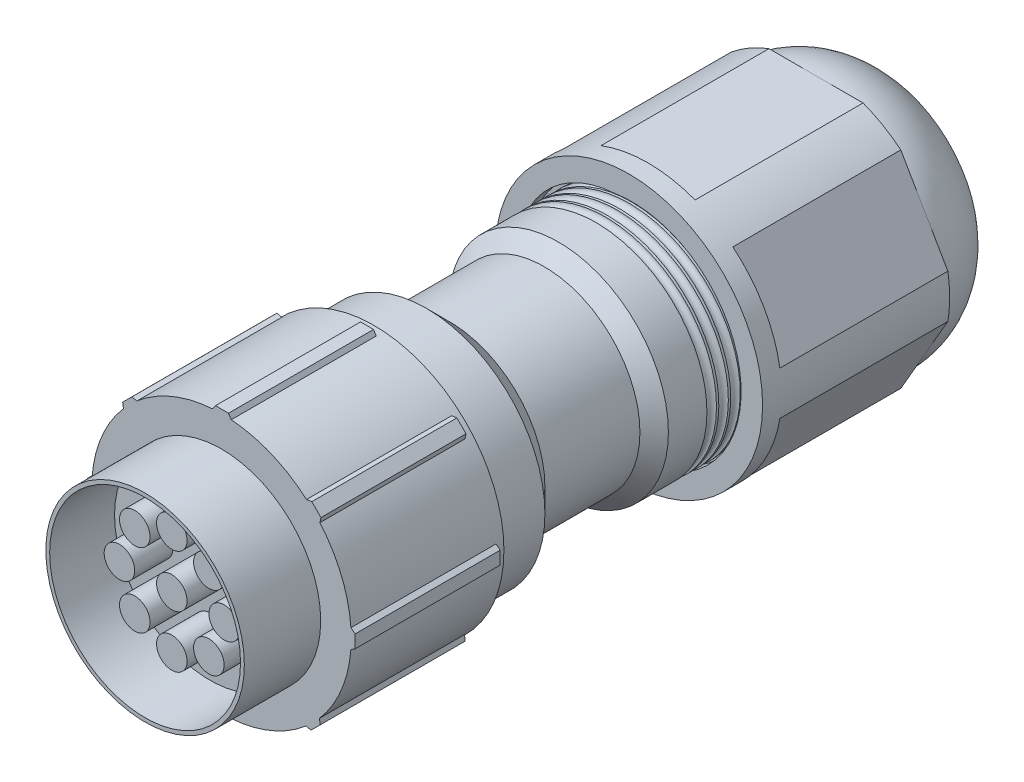
from build123d import *

# Parameters (mm, degrees)
SKETCH1_R           = 8.5
BOSS_EXTRUDE1_DEPTH = 10
SKETCH2_R           = 6.5
BOSS_EXTRUDE2_DEPTH = 5
BOSS_EXTRUDE3_START = 3.5
SKETCH4_R           = 7.195040541
BOSS_EXTRUDE3_DEPTH = 3.5
CUT_SWEEP2_PITCH    = 0.777777778
SKETCH7_R           = 8.75
BOSS_EXTRUDE5_DEPTH = 11.5
SKETCH10_R          = 3
CUT_EXTRUDE1_DEPTH  = 3
SKETCH11_R          = 6.25
CUT_EXTRUDE2_DEPTH  = 4.25
SKETCH12_R          = 1
BOSS_EXTRUDE6_DEPTH = 2.5
CIRPATTERN1_COUNT   = 8
BOSS_EXTRUDE7_DEPTH = 9.5
CIRPATTERN2_COUNT   = 8
BOSS_EXTRUDE8_START = 0.75
BOSS_EXTRUDE8_DEPTH = 0.75
CUT_EXTRUDE3_DEPTH  = 11
CIRPATTERN3_COUNT   = 6


with BuildPart() as part:
    # Sketch1 → Boss-Extrude1 (new body)
    with BuildSketch(Plane.XY):
        Circle(SKETCH1_R)
    extrude(amount=-BOSS_EXTRUDE1_DEPTH)

    # Sketch2 → Boss-Extrude2 (add)
    with BuildSketch(Plane.XY):
        Circle(SKETCH2_R)
    extrude(amount=BOSS_EXTRUDE2_DEPTH)

    # Sketch3 → Revolve1 (revolve)
    with BuildSketch(Plane(origin=(0, 0, 0), x_dir=(0, 0, -1), z_dir=(1, 0, 0)), mode=Mode.PRIVATE) as revolve1_sk:
        Polygon((10, 7.766162729), (13.419300919, 7.766162729), (14.922254046, 6.263209602), (21.14447999, 6.263209602), (22.076310929, 7.195040541), (23.939972806, 7.195040541), (23.939972806, 0), (10, 0), align=None)
    revolve(revolve1_sk.sketch.rotate(Axis((0, 0, -23.939972806), (0, 0, 1)), 90), axis=Axis((0, 0, -23.939972806), (0, 0, 1)))

    # Sketch4 → Boss-Extrude3 (add)
    with BuildSketch(Plane(origin=(0, 0, -23.939972806), x_dir=(-1, 0, 0), z_dir=(0, 0, -1)).offset(BOSS_EXTRUDE3_START)):
        Circle(SKETCH4_R)
    extrude(amount=-BOSS_EXTRUDE3_DEPTH)

    # Cut-Sweep2: arcs per turn and ends read off the stored shape
    # Cut-Sweep2: the profile of Sketch6 screwed along a right-hand helix through 4 turns, 8 arcs to a turn; built about Z, then put on its axis
    cut_sweep2_z = Axis((0, 0, 0), (0, 0, 1))
    cut_sweep2_corners = [(-7.195040541, 0, -0.312225385), (-6.882815156, 0, 0), (-7.195040541, 0, 0.312225385), (-7.507265926, 0, 0)]
    with BuildLine(mode=Mode.PRIVATE) as cut_sweep2_profile:
        ThreePointArc((-7.195040541, 0, -0.312225385), (-6.974263854, 0, -0.220776687), (-6.882815156, 0, 0))
        ThreePointArc((-6.882815156, 0, 0), (-6.974263854, 0, 0.220776687), (-7.195040541, 0, 0.312225385))
        ThreePointArc((-7.195040541, 0, 0.312225385), (-7.415817228, 0, 0.220776687), (-7.507265926, 0, 0))
        ThreePointArc((-7.507265926, 0, 0), (-7.415817228, 0, -0.220776687), (-7.195040541, 0, -0.312225385))
    cut_sweep2_cap = Face(cut_sweep2_profile.wire())
    cut_sweep2_arcs = [((-7.195040541, 0, -0.312225385), (-6.882815156, 0, -0.312225385), (-6.882815156, 0, 0), (1, 0.7071067811865476, 1)), ((-6.882815156, 0, 0), (-6.882815156, 0, 0.312225385), (-7.195040541, 0, 0.312225385), (1, 0.7071067811865476, 1)), ((-7.195040541, 0, 0.312225385), (-7.507265926, 0, 0.312225385), (-7.507265926, 0, 0), (1, 0.7071067811865476, 1)), ((-7.507265926, 0, 0), (-7.507265926, 0, -0.312225385), (-7.195040541, 0, -0.312225385), (1, 0.7071067811865476, 1))]  # start, shoulder, end, weights
    cut_sweep2_turn_angles = [0, 22.5, 45, 67.5, 90, 112.5, 135, 157.5, 180, 202.5, 225, 247.5, 270, 292.5, 315, 337.5, 360]
    cut_sweep2_turn_weights = [1, 0.9238795325112867, 1, 0.9238795325112867, 1, 0.9238795325112867, 1, 0.9238795325112867, 1, 0.9238795325112867, 1, 0.9238795325112867, 1, 0.9238795325112867, 1, 0.9238795325112867, 1]
    cut_sweep2_turn_sides = [Face.make_bezier_surface([[Vector(p[j][0], p[j][1], 0).rotate(cut_sweep2_z, cut_sweep2_turn_angles[2 * i + k]) / cut_sweep2_turn_weights[2 * i + k] + Vector(0, 0, p[j][2] + CUT_SWEEP2_PITCH * cut_sweep2_turn_angles[2 * i + k] / 360) for k in range(3)] for j in range(3)], [[p[3][j] * cut_sweep2_turn_weights[2 * i + k] for k in range(3)] for j in range(3)]) for p in cut_sweep2_arcs for i in range(8)]
    cut_sweep2 = Plane(origin=(0, 0, -27.439972806), x_dir=(0, 1, 0), z_dir=(0, 0, 1)) * Solid(Shell([*[p.moved(Location((0, 0, CUT_SWEEP2_PITCH * i))) for i in range(4) for p in cut_sweep2_turn_sides], cut_sweep2_cap, cut_sweep2_cap.rotate(cut_sweep2_z, 1440).moved(Location((0, 0, CUT_SWEEP2_PITCH * 1440 / 360)))]))
    add(cut_sweep2, mode=Mode.SUBTRACT)

    # Sketch7 → Boss-Extrude5 (add)
    with BuildSketch(Plane(origin=(0, 0, -27.439972806), x_dir=(-1, 0, 0), z_dir=(0, 0, -1))):
        Circle(SKETCH7_R)
    extrude(amount=BOSS_EXTRUDE5_DEPTH)

    # Sketch8 → Revolve3 (revolve)
    with BuildSketch(Plane(origin=(0, 0, 0), x_dir=(0, 0, -1), z_dir=(1, 0, 0)), mode=Mode.PRIVATE) as revolve3_sk:
        with BuildLine():
            Line((38.939972806, 0), (38.939972806, 8.190865712))
            ThreePointArc((38.939972806, 8.190865712), (41.2665522, 7.781579121), (43.155119701, 6.362494914))
            Line((43.155119701, 6.362494914), (43.155119701, 0))
            Line((43.155119701, 0), (41.997846182, 0))
            Line((41.997846182, 0), (38.939972806, 0))
        make_face()
    revolve(revolve3_sk.sketch.rotate(Axis((0, 0, -41.997846182), (0, 0, 1)), 90), axis=Axis((0, 0, -41.997846182), (0, 0, 1)))

    # Sketch10 → Cut-Extrude1 (cut)
    with BuildSketch(Plane(origin=(0, 0, -43.155119701), x_dir=(-1, 0, 0), z_dir=(0, 0, -1))):
        Circle(SKETCH10_R)
    extrude(amount=-CUT_EXTRUDE1_DEPTH, mode=Mode.SUBTRACT)

    # Sketch11 → Cut-Extrude2 (cut)
    with BuildSketch(Plane.XY.offset(5)):
        Circle(SKETCH11_R)
    extrude(amount=-CUT_EXTRUDE2_DEPTH, mode=Mode.SUBTRACT)

    # Sketch12 → Boss-Extrude6 (add)
    with BuildSketch(Plane.XY.offset(0.75)):
        Circle(SKETCH12_R)
        with Locations((0, 3.43)):
            Circle(SKETCH12_R)
    boss_extrude6 = extrude(amount=BOSS_EXTRUDE6_DEPTH)

    # CirPattern1: Boss-Extrude6 ×8 about axis
    cirpattern1_axis = Axis((0, 0, 0), (0, 0, 1))
    for i in range(1, CIRPATTERN1_COUNT):
        add(boss_extrude6.rotate(cirpattern1_axis, i * 360 / CIRPATTERN1_COUNT))

    # Sketch14 → Boss-Extrude7 (add)
    with BuildSketch(Plane.XY):
        Polygon((-0.597109583, 8.479001129), (0.022890417, 8.471229408), (0.642890417, 8.47565289), (0.46177716, 8.75565289), (-0.388250759, 8.759001129), align=None)
    boss_extrude7 = extrude(amount=-BOSS_EXTRUDE7_DEPTH)

    # CirPattern2: Boss-Extrude7 ×8 about axis
    cirpattern2_axis = Axis((0, 0, 0), (0, 0, 1))
    for i in range(1, CIRPATTERN2_COUNT):
        add(boss_extrude7.rotate(cirpattern2_axis, i * 360 / CIRPATTERN2_COUNT))

    # Sketch15 → Boss-Extrude8 (add)
    with BuildSketch(Plane.XY.offset(-27.439972806).offset(BOSS_EXTRUDE8_START)):
        with BuildLine():
            ThreePointArc((-0.988548069, 8.693979107), (-6.527338493, 5.827207925), (-8.75, 0))
            ThreePointArc((-8.75, 0), (-6.29519092, -6.077258533), (-0.308155135, -8.744572054))
            ThreePointArc((-0.308155135, -8.744572054), (6.077258533, -6.29519092), (8.75, 0))
            ThreePointArc((8.75, 0), (5.827207925, 6.527338493), (-0.988548069, 8.693979107))
        make_face()
        with BuildLine():
            ThreePointArc((-0.988548069, 7.17422776), (-5.618268786, 4.889355548), (-7.276327064, 0))
            ThreePointArc((-7.276327064, 0), (-5.927223364, -4.357933307), (-2.21659335, -7.011777387))
            ThreePointArc((-2.21659335, -7.011777387), (5.102583825, -5.238548112), (7.08034461, 2.028030096))
            ThreePointArc((7.08034461, 2.028030096), (4.036675809, 6.154601637), (-0.988548069, 7.17422776))
        make_face(mode=Mode.SUBTRACT)
    extrude(amount=-BOSS_EXTRUDE8_DEPTH)

    # Sketch16 → Cut-Extrude3 (cut)
    with BuildSketch(Plane(origin=(0, 0, -38.939972806), x_dir=(-1, 0, 0), z_dir=(0, 0, -1))):
        Polygon((-0.029619759, 8.851786246), (-3.529619759, 8.851786246), (-3.529619759, 8.189592106), (3.470380241, 8.189592106), (3.470380241, 8.851786246), align=None)
    cut_extrude3 = extrude(amount=-CUT_EXTRUDE3_DEPTH, mode=Mode.SUBTRACT)

    # CirPattern3: Cut-Extrude3 ×6 about axis
    cirpattern3_axis = Axis((0, 0, 0), (0, 0, 1))
    for i in range(1, CIRPATTERN3_COUNT):
        add(cut_extrude3.rotate(cirpattern3_axis, i * 360 / CIRPATTERN3_COUNT), mode=Mode.SUBTRACT)


solid = part.part
